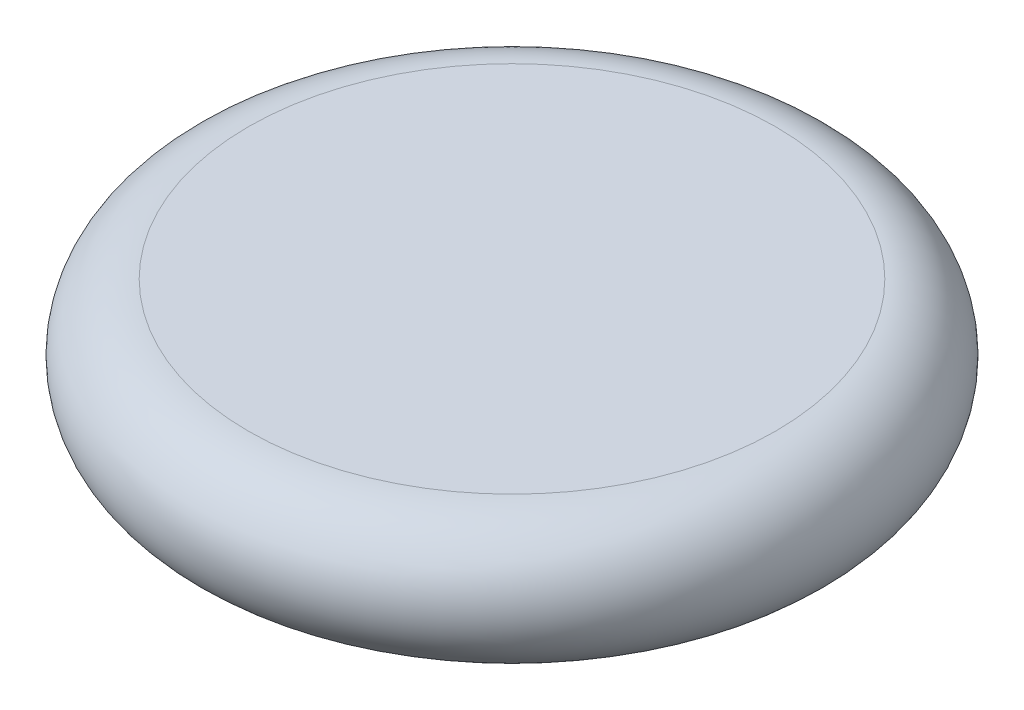
from build123d import *


with BuildPart() as part:
    # Sketch1 → Revolve2 (revolve)
    with BuildSketch(Plane.XY):
        with BuildLine():
            Line((0, 0), (0, -500))
            Line((0, -500), (1000, -500))
            ThreePointArc((1000, -500), (1250, -250), (1000, 0))
            Line((1000, 0), (0, 0))
        make_face()
    revolve(axis=Axis((0, 550, 0), (0, -1, 0)))


solid = part.part
